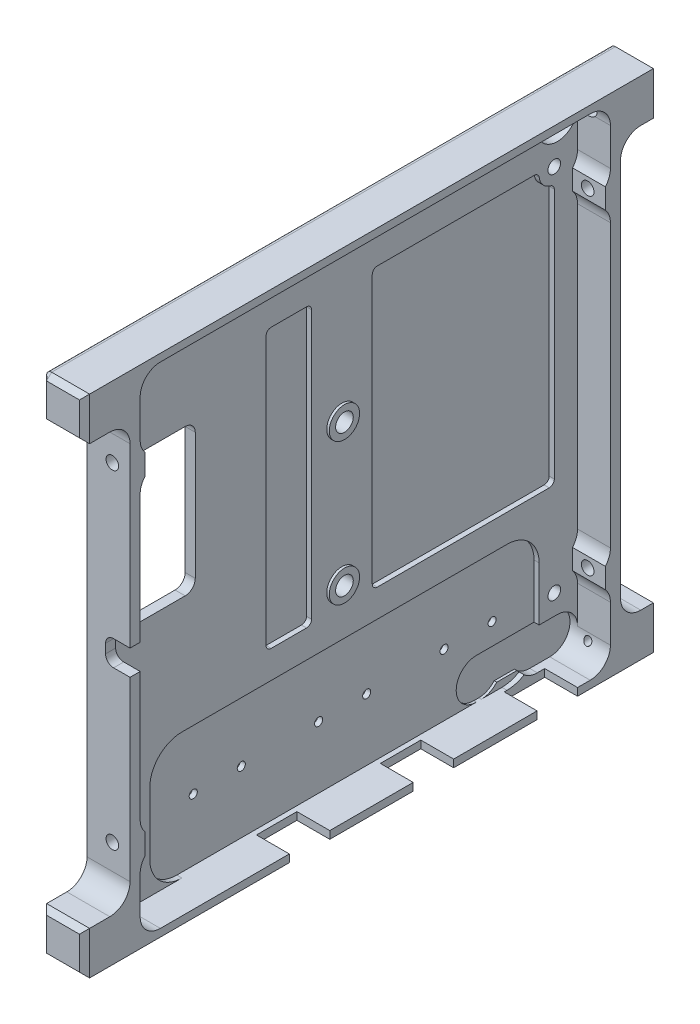
from build123d import *
from build123d.topology import SkipClean

# Parameters (mm, degrees)
SKETCH1_W                    = 81
SKETCH1_H                    = 83
BODY_DEPTH                   = 8.5
RAILFILLET_R                 = 1
FOOTCHAMFER_SIZE             = 1
SKETCH5_W                    = 81
SKETCH5_H                    = 83
BOSS_EXTRUDE3_DEPTH          = 8.5
SKETCH6_W                    = 93
SKETCH6_H                    = 97
CUT_EXTRUDE3_DEPTH           = 6.5
F_8_36_TAPPED_HOLE1_D        = 3.4544
F_8_36_TAPPED_HOLE1_DEPTH    = 13.55
F_8_36_TAPPED_HOLE1_TIP      = 1.037806461
SKETCH57_W                   = 1
SKETCH57_H                   = 4
BOSS_EXTRUDE24_DEPTH         = 6.5
FILLET5_R                    = 4
M3X0_5_TAPPED_HOLE1_D        = 2.5
FILLET7_R                    = 4
M3X0_5_TAPPED_HOLE2_D        = 2.5
M3X0_5_TAPPED_HOLE2_DEPTH    = 7.5
M3X0_5_TAPPED_HOLE2_TIP      = 0.751075774
FILLET8_R                    = 4
SKETCH70_R                   = 4
CUT_EXTRUDE14_DEPTH          = 1.5
SKETCH75_W                   = 8
SKETCH75_H                   = 4
BOSS_EXTRUDE25_DEPTH         = 1.4
M1_6X0_35_TAPPED_HOLE1_D     = 1.25
M1_6X0_35_TAPPED_HOLE1_DEPTH = 4.25
M1_6X0_35_TAPPED_HOLE1_TIP   = 0.375537887
FILLET9_R                    = 4
F_1_5MM_DOWEL_HOLE1_REACH    = 153.507
F_1_5MM_DOWEL_HOLE1_BORE_R   = 0.75
CUT_EXTRUDE15_DEPTH          = 152.408388147
SKETCH84_R                   = 1.75
CUT_EXTRUDE17_DEPTH          = 152.507425566
CUT_EXTRUDE18_DEPTH          = 2
SKETCH86_R                   = 0.8
CUT_EXTRUDE19_DEPTH          = 152.408388147
CUT_EXTRUDE21_DEPTH          = 152.408388147
CUT_EXTRUDE21_DEPTH_BACK     = 1
SKETCH91_W                   = 6.5
SKETCH91_H                   = 8
CUT_EXTRUDE22_DEPTH          = 10
SKETCH93_R                   = 3
SKETCH93_R_2                 = 1.75
BOSS_EXTRUDE26_DEPTH         = 0.5
CUT_EXTRUDE23_DEPTH          = 1
M2X0_4_TAPPED_HOLE1_D        = 1.6
M2X0_4_TAPPED_HOLE1_DEPTH    = 5.2
M2X0_4_TAPPED_HOLE1_TIP      = 0.480688495


# Some blends are built 0.0001 mm under size
with BuildPart() as part:
    # Sketch1 → Body (new body)
    with BuildSketch(Plane(origin=(0, 0, 0), x_dir=(0, 0, -1), z_dir=(1, 0, 0))):
        Polygon((-113.5, 0), (0, 0), (0, 8.5), (-7.5, 8.5), (-7.5, 91.5), (0, 91.5), (0, 100), (-113.5, 100), (-113.5, 91.5), (-104.5, 91.5), (-104.5, 8.5), (-113.5, 8.5), align=None)
        with Locations((-56, 50)):
            Rectangle(SKETCH1_W, SKETCH1_H, mode=Mode.SUBTRACT)
    extrude(amount=BODY_DEPTH)

    # RailFillet
    railfillet_edges = [part.edges().sort_by_distance(p)[0] for p in [
        (0, 0, 56.75),
        (0, 100, 56.75),
    ]]
    fillet(railfillet_edges, radius=RAILFILLET_R)

    # FootChamfer
    footchamfer_edges = [part.edges().sort_by_distance(p)[0] for p in [
        (8.5, 95.75, 0),
        (0, 95.25, 113.5),
        (8.5, 95.75, 113.5),
        (0, 95.25, 0),
        (4.25, 8.5, 0),
        (4.75, 0, 0),
        (4.75, 0, 113.5),
        (4.25, 8.5, 113.5),
        (4.25, 91.5, 113.5),
        (4.75, 100, 113.5),
        (4.75, 100, 0),
        (4.25, 91.5, 0),
        (8.5, 4.25, 113.5),
        (8.5, 4.25, 0),
        (0, 4.75, 0),
        (0, 4.75, 113.5),
        (0.292893219, 0.292893219, 113.5),
        (0.292893219, 0.292893219, 0),
        (0.292893219, 99.707106781, 113.5),
        (0.292893219, 99.707106781, 0),
    ]]
    chamfer(footchamfer_edges, length=FOOTCHAMFER_SIZE - 0.0001)  # a hair under: the kernel refuses the full size

    # Sketch5 → Boss-Extrude3 (add)
    with BuildSketch(Plane(origin=(8.5, 0, 0), x_dir=(0, 0, -1), z_dir=(1, 0, 0))):
        with Locations((-56, 50)):
            Rectangle(SKETCH5_W, SKETCH5_H)
    extrude(amount=-BOSS_EXTRUDE3_DEPTH)

    # Sketch6 → Cut-Extrude3 (cut)
    with BuildSketch(Plane(origin=(8.5, 0, 0), x_dir=(0, 0, -1), z_dir=(1, 0, 0))):
        with Locations((-56, 50)):
            Rectangle(SKETCH6_W, SKETCH6_H)
    extrude(amount=-CUT_EXTRUDE3_DEPTH, mode=Mode.SUBTRACT)

    # #8-36 Tapped Hole1
    with Locations(Plane(origin=(0, 0, 0), x_dir=(-1, 0, 0), z_dir=(0, 0, -1))):
        with Locations((-4.25, 95.75)):
            Hole(F_8_36_TAPPED_HOLE1_D / 2, depth=F_8_36_TAPPED_HOLE1_DEPTH)
            with Locations((0, 0, -(F_8_36_TAPPED_HOLE1_DEPTH + F_8_36_TAPPED_HOLE1_TIP / 2))):  # 118° drill point
                Cone(0, F_8_36_TAPPED_HOLE1_D / 2, F_8_36_TAPPED_HOLE1_TIP, mode=Mode.SUBTRACT)

    # Sketch57 → Boss-Extrude24 (add)
    with BuildSketch(Plane(origin=(2, 0, 0), x_dir=(0, 0, -1), z_dir=(1, 0, 0))):
        with Locations((-102, 82.5)):
            Rectangle(SKETCH57_W, SKETCH57_H)
        with Locations((-102, 17.5)):
            Rectangle(SKETCH57_W, SKETCH57_H)
        with Locations((-10, 17.5)):
            Rectangle(SKETCH57_W, SKETCH57_H)
        with Locations((-10, 82.5)):
            Rectangle(SKETCH57_W, SKETCH57_H)
    extrude(amount=BOSS_EXTRUDE24_DEPTH)

    # Fillet5
    # the kernel refuses this fillet: 4 mm, written as the material it adds along each edge
    with BuildSketch(Plane(origin=(2, 84.5, 102.5), x_dir=(0, 1, 0), z_dir=(1, 0, 0)), Plane(origin=(2, 19.5, 102.5), x_dir=(0, 1, 0), z_dir=(1, 0, 0)), Plane(origin=(2, 15.5, 9.5), x_dir=(0, -1, 0), z_dir=(1, 0, 0)), Plane(origin=(2, 80.5, 9.5), x_dir=(0, -1, 0), z_dir=(1, 0, 0))) as fillet5_piece_1:
        with BuildLine():
            CenterArc((2.645751311, -4), FILLET5_R, 90, 41.409622109)
            Line((0, -1), (-0.052915026, -0.94))
            ThreePointArc((-0.052915026, -0.94), (-0.08, -0.5), (-0.08, 0))
            Line((-0.08, 0), (0, 0.08))
            Line((0, 0.08), (2.645751311, 0.08))
            Line((2.645751311, 0.08), (2.645751311, 0))
        make_face()
    extrude(amount=6.5)
    with BuildSketch(Plane(origin=(2, 80.5, 102.5), x_dir=(0, -1, 0), z_dir=(1, 0, 0)), Plane(origin=(2, 15.5, 102.5), x_dir=(0, -1, 0), z_dir=(1, 0, 0)), Plane(origin=(2, 19.5, 9.5), x_dir=(0, 1, 0), z_dir=(1, 0, 0)), Plane(origin=(2, 84.5, 9.5), x_dir=(0, 1, 0), z_dir=(1, 0, 0))) as fillet5_piece_2:
        with BuildLine():
            CenterArc((2.645751311, 4), FILLET5_R, 228.590377891, 41.409622109)
            Line((0, 1), (-0.052915026, 0.94))
            ThreePointArc((-0.052915026, 0.94), (-0.08, 0.5), (-0.08, 0))
            Line((-0.08, 0), (0, -0.08))
            Line((0, -0.08), (2.645751311, -0.08))
            Line((2.645751311, -0.08), (2.645751311, 0))
        make_face()
    extrude(amount=6.5)

    # M3x0.5 Tapped Hole1 (through all)
    with Locations(Plane(origin=(0, 0, 7.5), x_dir=(-1, 0, 0), z_dir=(0, 0, -1))):
        with Locations((-5, 82.5), (-5, 17.5)):
            Hole(M3X0_5_TAPPED_HOLE1_D / 2)

    # Fillet7
    # the kernel refuses this fillet: 4 mm, written as the material it adds along each edge
    with BuildSketch(Plane(origin=(8.5, 1.5, 102.5), x_dir=(0, 1, 0), z_dir=(-1, 0, 0)), Plane(origin=(8.5, 98.5, 102.5), x_dir=(0, 0, -1), z_dir=(-1, 0, 0)), Plane(origin=(8.5, 1.5, 9.5), x_dir=(0, 0, 1), z_dir=(-1, 0, 0))) as fillet7_piece_1:
        with BuildLine():
            CenterArc((FILLET7_R, FILLET7_R), FILLET7_R, 180, 90)
            Line((0, FILLET7_R), (0, 0))
            Line((0, 0), (FILLET7_R, 0))
        make_face()
    extrude(amount=6.5)
    with BuildSketch(Plane(origin=(8.5, 98.5, 9.5), x_dir=(0, -1, 0), z_dir=(-1, 0, 0))) as fillet7_piece_2_section:
        with BuildLine():
            CenterArc((FILLET7_R, FILLET7_R), FILLET7_R, 180, 90)
            Line((0, FILLET7_R), (0, 0))
            Line((0, 0), (FILLET7_R, 0))
        make_face()
    fillet7_piece_2 = extrude(amount=6.5, mode=Mode.PRIVATE)
    fillet7_piece_2 = fillet7_piece_2 - Plane(origin=(4.25, 95.75, 10.508429102), x_dir=(1, 0, 0), z_dir=(0, 0, 1)) * Cylinder(1.7272, 29, mode=Mode.PRIVATE)
    add(fillet7_piece_2)

    # M3x0.5 Tapped Hole2
    with Locations(Plane.ZY):
        with Locations((14.1, 13.5), (14.1, 86.5), (98.1, 86.5), (98.1, 13.5)):
            Hole(M3X0_5_TAPPED_HOLE2_D / 2, depth=M3X0_5_TAPPED_HOLE2_DEPTH)
            with Locations((0, 0, -(M3X0_5_TAPPED_HOLE2_DEPTH + M3X0_5_TAPPED_HOLE2_TIP / 2))):  # 118° drill point
                Cone(0, M3X0_5_TAPPED_HOLE2_D / 2, M3X0_5_TAPPED_HOLE2_TIP, mode=Mode.SUBTRACT)

    # Fillet8
    fillet8_edges = [part.edges().sort_by_distance(p)[0] for p in [
        (4.25, 8.5, 7.5),
        (4.25, 8.5, 104.5),
        (4.25, 91.5, 104.5),
        (4.25, 91.5, 7.5),
    ]]
    fillet(fillet8_edges, radius=FILLET8_R)

    # Sketch70 → Cut-Extrude14 (cut)
    with BuildSketch(Plane(origin=(2, 0, 0), x_dir=(0, 0, -1), z_dir=(1, 0, 0))):
        with BuildLine():
            ThreePointArc((-13.5, 1.5), (-9.5, 5.5), (-13.5, 9.5))
            Line((-13.5, 9.5), (-28.5, 9.5))
            ThreePointArc((-28.5, 9.5), (-32.5, 5.5), (-28.5, 1.5))
            Line((-28.5, 1.5), (-13.5, 1.5))
        make_face()
        with Locations((-13.5, 94.5)):
            Circle(SKETCH70_R)
    extrude(amount=-CUT_EXTRUDE14_DEPTH, mode=Mode.SUBTRACT)

    # Sketch75 → Boss-Extrude25 (add)
    with BuildSketch(Plane(origin=(0, 1.5, 0), x_dir=(1, 0, 0), z_dir=(0, 1, 0))):
        with Locations((4.5, -22.5)):
            Rectangle(SKETCH75_W, SKETCH75_H)
    extrude(amount=BOSS_EXTRUDE25_DEPTH)

    # M1.6x0.35 Tapped Hole1
    with Locations(Plane(origin=(0, 2.9, 0), x_dir=(1, 0, 0), z_dir=(0, 1, 0))):
        with Locations((2.8, -22.5), (6.8, -22.5)):
            Hole(M1_6X0_35_TAPPED_HOLE1_D / 2, depth=M1_6X0_35_TAPPED_HOLE1_DEPTH)
            with Locations((0, 0, -(M1_6X0_35_TAPPED_HOLE1_DEPTH + M1_6X0_35_TAPPED_HOLE1_TIP / 2))):  # 118° drill point
                Cone(0, M1_6X0_35_TAPPED_HOLE1_D / 2, M1_6X0_35_TAPPED_HOLE1_TIP, mode=Mode.SUBTRACT)

    # Fillet9
    # the kernel refuses this fillet: 4 mm, written as the material it adds along each edge
    with BuildSketch(Plane(origin=(8.5, 1.5, 24.5), x_dir=(0, 1, 0), z_dir=(-1, 0, 0))) as fillet9_piece_1:
        with BuildLine():
            CenterArc((4, -3.039736831), FILLET9_R, 130.541601874, 49.458398126)
            Line((0, -3.039736831), (-0.08, -3.039736831))
            Line((-0.08, -3.039736831), (-0.08, 0))
            Line((-0.08, 0), (0, 0.08))
            ThreePointArc((0, 0.08), (0.7, 0.08), (1.348, 0.060794737))
            Line((1.348, 0.060794737), (1.4, 0))
        make_face()
    extrude(amount=6.5)
    with BuildSketch(Plane(origin=(2, 1.5, 20.5), x_dir=(0, 0, -1), z_dir=(1, 0, 0))) as fillet9_piece_2:
        with BuildLine():
            CenterArc((3.039736831, 4), FILLET9_R, 220.541601874, 49.458398126)
            Line((0, 1.4), (-0.060794737, 1.348))
            ThreePointArc((-0.060794737, 1.348), (-0.08, 0.7), (-0.08, 0))
            Line((-0.08, 0), (0, -0.08))
            Line((0, -0.08), (3.039736831, -0.08))
            Line((3.039736831, -0.08), (3.039736831, 0))
        make_face()
    extrude(amount=6.5)
    with BuildSketch(Plane(origin=(0.5, 1.5, 20.5), x_dir=(0, 1, 0), z_dir=(1, 0, 0)), Plane(origin=(2, 1.5, 24.5), x_dir=(0, 1, 0), z_dir=(-1, 0, 0))) as fillet9_piece_3:
        with BuildLine():
            CenterArc((4, -3.039736831), FILLET9_R, 130.541601874, 49.458398126)
            Line((0, -3.039736831), (-0.08, -3.039736831))
            Line((-0.08, -3.039736831), (-0.08, 0))
            Line((-0.08, 0), (0, 0.08))
            ThreePointArc((0, 0.08), (0.7, 0.08), (1.348, 0.060794737))
            Line((1.348, 0.060794737), (1.4, 0))
        make_face()
    extrude(amount=1.5)

    # Ø1.5mm Dowel Hole1 bore → Ø1.5mm Dowel Hole1 (cut, up to next)
    with BuildSketch(Plane(origin=(0, 0, 0), x_dir=(-1, 0, 0), z_dir=(0, 0, -1)), mode=Mode.PRIVATE) as f_1_5mm_dowel_hole1_sk1:
        with Locations((-4.25, 4.25)):
            Circle(F_1_5MM_DOWEL_HOLE1_BORE_R)
    f_1_5mm_dowel_hole1_tool1 = extrude(f_1_5mm_dowel_hole1_sk1.sketch, amount=-F_1_5MM_DOWEL_HOLE1_REACH, mode=Mode.PRIVATE) & part.part
    add(f_1_5mm_dowel_hole1_tool1.solids().sort_by_distance((4.25, 4.25, 0))[0], mode=Mode.SUBTRACT)

    # Sketch81 → Cut-Extrude15 (cut, through all)
    with SkipClean():  # the faces are left unmerged after this step: merging them gives an invalid solid
        with BuildSketch(Plane(origin=(2, 0, 0), x_dir=(0, 0, -1), z_dir=(1, 0, 0))):
            with BuildLine():
                ThreePointArc((-102.5, 51.5), (-101.914213562, 50.085786438), (-100.5, 49.5))
                ThreePointArc((-100.5, 49.5), (-99.085786438, 50.085786438), (-98.5, 51.5))
                Line((-98.5, 51.5), (-98.5, 76.5))
                ThreePointArc((-98.5, 76.5), (-99.085786438, 77.914213562), (-100.5, 78.5))
                ThreePointArc((-100.5, 78.5), (-101.914213562, 77.914213562), (-102.5, 76.5))
                Line((-102.5, 76.5), (-102.5, 51.5))
            make_face()
            with BuildLine():
                Line((-85.1, 51.5), (-85.1, 76.5))
                ThreePointArc((-85.1, 76.5), (-87.1, 78.5), (-89.1, 76.5))
                Line((-89.1, 76.5), (-89.1, 51.5))
                ThreePointArc((-89.1, 51.5), (-87.1, 49.5), (-85.1, 51.5))
            make_face()
            with BuildLine():
                ThreePointArc((-87.1, 49.5), (-88.514213562, 50.085786438), (-89.1, 51.5))
                Line((-89.1, 51.5), (-89.1, 76.5))
                ThreePointArc((-89.1, 76.5), (-88.514213562, 77.914213562), (-87.1, 78.5))
                Line((-87.1, 78.5), (-100.5, 78.5))
                ThreePointArc((-100.5, 78.5), (-99.085786438, 77.914213562), (-98.5, 76.5))
                Line((-98.5, 76.5), (-98.5, 51.5))
                ThreePointArc((-98.5, 51.5), (-99.085786438, 50.085786438), (-100.5, 49.5))
                Line((-100.5, 49.5), (-87.1, 49.5))
            make_face()
        extrude(amount=-CUT_EXTRUDE15_DEPTH, mode=Mode.SUBTRACT)

    # Sketch84 → Cut-Extrude17 (cut, through all)
    with SkipClean():  # the faces are left unmerged after this step: merging them gives an invalid solid
        with BuildSketch(Plane.ZY):
            with Locations((56.1, 36)):
                Circle(SKETCH84_R)
            with Locations((56.1, 64)):
                Circle(SKETCH84_R)
        extrude(amount=-CUT_EXTRUDE17_DEPTH, mode=Mode.SUBTRACT)

    # Sketch85 → Cut-Extrude18 (cut)
    with BuildSketch(Plane.XY.offset(104.5)):
        with BuildLine():
            Line((5.25, 47.5), (8.5, 47.5))
            Line((8.5, 47.5), (8.5, 52.5))
            Line((8.5, 52.5), (5.25, 52.5))
            ThreePointArc((5.25, 52.5), (4.125700218, 52.034299782), (3.66, 50.91))
            Line((3.66, 50.91), (3.66, 49.09))
            ThreePointArc((3.66, 49.09), (4.125700218, 47.965700218), (5.25, 47.5))
        make_face()
    extrude(amount=-CUT_EXTRUDE18_DEPTH, mode=Mode.SUBTRACT)

    # Sketch86 → Cut-Extrude19 (cut, through all)
    with BuildSketch(Plane(origin=(2, 0, 0), x_dir=(0, 0, -1), z_dir=(1, 0, 0))):
        with Locations((-50.199999999, 13.75)):
            Circle(SKETCH86_R)
        with Locations((-59.699999999, 13.75)):
            Circle(SKETCH86_R)
        with Locations((-75, 13.75)):
            Circle(SKETCH86_R)
        with Locations((-84.5, 13.75)):
            Circle(SKETCH86_R)
        with Locations((-34.899999999, 13.75)):
            Circle(SKETCH86_R)
        with Locations((-25.399999999, 13.75)):
            Circle(SKETCH86_R)
    extrude(amount=-CUT_EXTRUDE19_DEPTH, mode=Mode.SUBTRACT)

    # Sketch90 → Cut-Extrude21 (cut, two sides: drawn at the far end of the back side and taken through both)
    with BuildSketch(Plane(origin=(2, 0, 0), x_dir=(0, 0, -1), z_dir=(1, 0, 0)).offset(-CUT_EXTRUDE21_DEPTH_BACK)):
        with BuildLine():
            Line((-87.75, 1.5), (-23.45, 1.5))
            ThreePointArc((-23.45, 1.5), (-18.959871939, 3.359871939), (-17.1, 7.85))
            Line((-17.1, 7.85), (-17.1, 20.15))
            ThreePointArc((-17.1, 20.15), (-18.959871939, 24.640128061), (-23.45, 26.5))
            Line((-23.45, 26.5), (-87.75, 26.5))
            ThreePointArc((-87.75, 26.5), (-92.240128061, 24.640128061), (-94.1, 20.15))
            Line((-94.1, 20.15), (-94.1, 7.85))
            ThreePointArc((-94.1, 7.85), (-92.240128061, 3.359871939), (-87.75, 1.5))
        make_face()
    extrude(amount=CUT_EXTRUDE21_DEPTH + CUT_EXTRUDE21_DEPTH_BACK, mode=Mode.SUBTRACT)

    # Sketch91 → Cut-Extrude22 (cut)
    with BuildSketch(Plane.XZ):
        with Locations((5.25, 20)):
            Rectangle(SKETCH91_W, SKETCH91_H)
        with Locations((5.25, 44.5)):
            Rectangle(SKETCH91_W, SKETCH91_H)
        with Locations((5.25, 69)):
            Rectangle(SKETCH91_W, SKETCH91_H)
    extrude(amount=-CUT_EXTRUDE22_DEPTH, mode=Mode.SUBTRACT)

    # Sketch93 → Boss-Extrude26 (add)
    # profile 1 of 2: a face of its own
    with BuildSketch(Plane(origin=(2, 0, 0), x_dir=(0, 0, -1), z_dir=(1, 0, 0))):
        with Locations((-56.1, 64)):
            Circle(SKETCH93_R)
        with Locations(Location((-56.1, 64, 0), (0, 0, 180))):
            Circle(SKETCH93_R_2, mode=Mode.SUBTRACT)
    # profile 2 of 2: a face of its own
    with BuildSketch(Plane(origin=(2, 0, 0), x_dir=(0, 0, -1), z_dir=(1, 0, 0))):
        with Locations((-56.1, 36)):
            Circle(SKETCH93_R)
        with Locations(Location((-56.1, 36, 0), (0, 0, 180))):
            Circle(SKETCH93_R_2, mode=Mode.SUBTRACT)
    extrude(amount=BOSS_EXTRUDE26_DEPTH)

    # Sketch94 → Cut-Extrude23 (cut)
    with BuildSketch(Plane(origin=(2, 0, 0), x_dir=(0, 0, -1), z_dir=(1, 0, 0))):
        with BuildLine():
            Line((-18.07, 87), (-49.1, 87))
            ThreePointArc((-49.1, 87), (-49.807106781, 86.707106781), (-50.1, 86))
            Line((-50.1, 86), (-50.1, 33))
            ThreePointArc((-50.1, 33), (-49.807106781, 32.292893219), (-49.1, 32))
            Line((-49.1, 32), (-15.1, 32))
            ThreePointArc((-15.1, 32), (-14.392893219, 32.292893219), (-14.1, 33))
            Line((-14.1, 33), (-14.1, 82.63))
            ThreePointArc((-14.1, 82.63), (-14.309573629, 83.242557061), (-14.850452305, 83.598362509))
            ThreePointArc((-14.850452305, 83.598362509), (-16.352491798, 84.519910789), (-17.077952305, 86.125862509))
            ThreePointArc((-17.077952305, 86.125862509), (-17.40888825, 86.750287448), (-18.07, 87))
        make_face()
        with BuildLine():
            Line((-70.1, 32), (-63.1, 32))
            ThreePointArc((-63.1, 32), (-62.392893219, 32.292893219), (-62.1, 33))
            Line((-62.1, 33), (-62.1, 86))
            ThreePointArc((-62.1, 86), (-62.392893219, 86.707106781), (-63.1, 87))
            Line((-63.1, 87), (-70.1, 87))
            ThreePointArc((-70.1, 87), (-70.807106781, 86.707106781), (-71.1, 86))
            Line((-71.1, 86), (-71.1, 33))
            ThreePointArc((-71.1, 33), (-70.807106781, 32.292893219), (-70.1, 32))
        make_face()
    extrude(amount=-CUT_EXTRUDE23_DEPTH, mode=Mode.SUBTRACT)

    # M2x0.4 Tapped Hole1
    with Locations(Plane(origin=(1, 13.75, 84.5), x_dir=(0, 0, 1), z_dir=(1, 0, 0))):
        with Locations((0, 0), (-9.5, 0), (-24.800000001, 0), (-34.300000001, 0), (-49.600000001, 0), (-59.100000001, 0)):
            Hole(M2X0_4_TAPPED_HOLE1_D / 2, depth=M2X0_4_TAPPED_HOLE1_DEPTH)
            with Locations((0, 0, -(M2X0_4_TAPPED_HOLE1_DEPTH + M2X0_4_TAPPED_HOLE1_TIP / 2))):  # 118° drill point
                Cone(0, M2X0_4_TAPPED_HOLE1_D / 2, M2X0_4_TAPPED_HOLE1_TIP, mode=Mode.SUBTRACT)


solid = part.part
